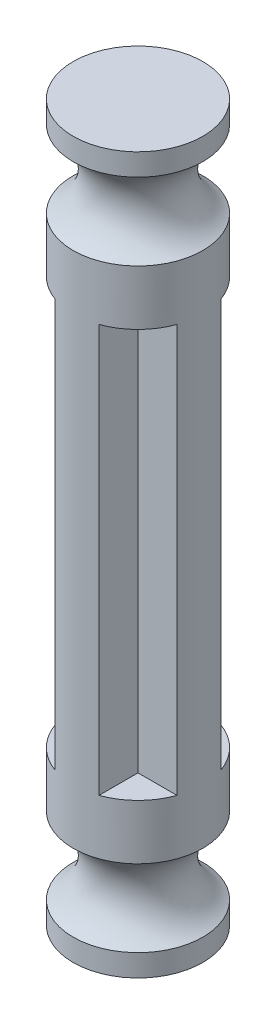
from build123d import *
from build123d.topology import SkipClean

# Parameters (mm, degrees)
EXTRUDE_2_DEPTH = 18.56


with BuildPart() as part:
    # 草图1 → 凸台-拉伸2 (new body)
    with BuildSketch(Plane(origin=(0, 0, 0), x_dir=(1, 0, 0), z_dir=(0, 1, 0))):
        with BuildLine():
            Line((1, 1), (1, 2.775337817))
            ThreePointArc((1, 2.775337817), (0, 2.95), (-1, 2.775337817))
            Line((-1, 2.775337817), (-1, 1))
            Line((-1, 1), (-2.775337817, 1))
            ThreePointArc((-2.775337817, 1), (-2.95, 0), (-2.775337817, -1))
            Line((-2.775337817, -1), (-1, -1))
            Line((-1, -1), (-1, -2.775337817))
            ThreePointArc((-1, -2.775337817), (0, -2.95), (1, -2.775337817))
            Line((1, -2.775337817), (1, -1))
            Line((1, -1), (2.775337817, -1))
            ThreePointArc((2.775337817, -1), (2.95, 0), (2.775337817, 1))
            Line((2.775337817, 1), (1, 1))
        make_face()
    extrude(amount=EXTRUDE_2_DEPTH)

    # 草图3 → 旋转3 (revolve)
    with SkipClean():  # the faces are left unmerged after this step: merging them gives an invalid solid
        with BuildSketch(Plane(origin=(0, 0, 0), x_dir=(0, 0, -1), z_dir=(1, 0, 0))):
            with BuildLine():
                Line((0, 18.56), (0, 25.56))
                Line((0, 25.56), (2.95, 25.56))
                Line((2.95, 25.56), (2.95, 24.56))
                ThreePointArc((2.95, 24.56), (1.918245837, 22.81), (2.95, 21.06))
                Line((2.95, 21.06), (2.95, 18.56))
                Line((2.95, 18.56), (0, 18.56))
            make_face()
            with BuildLine():
                Line((0, 0), (0, -7))
                Line((0, -7), (2.95, -7))
                Line((2.95, -7), (2.95, -6))
                ThreePointArc((2.95, -6), (1.918245837, -4.25), (2.95, -2.5))
                Line((2.95, -2.5), (2.95, 0))
                Line((2.95, 0), (0, 0))
            make_face()
        revolve(axis=Axis((0, 0, 0), (0, -1, 0)))


solid = part.part
